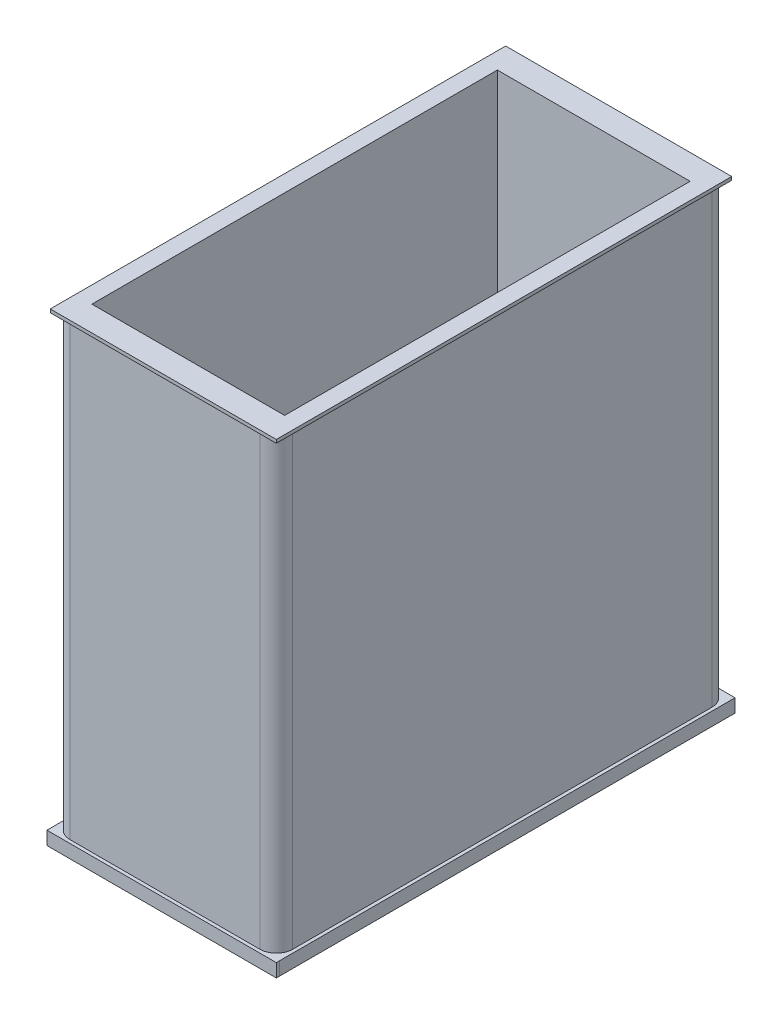
from build123d import *

# Parameters (mm, degrees)
SKETCH1_W            = 169.926
SKETCH1_H            = 344.932
BOSS_EXTRUDE1_DEPTH  = 379.984
SKETCH7_W            = 344.932
SKETCH7_H            = 10.16
BOSS_EXTRUDE4_DEPTH  = 2.54
SKETCH8_W            = 344.932
SKETCH8_H            = 10.16
BOSS_EXTRUDE5_DEPTH  = 2.54
SKETCH9_W            = 175.006
SKETCH9_H            = 10.16
BOSS_EXTRUDE6_DEPTH  = 2.54
SKETCH13_W           = 344.932
SKETCH13_H           = 2.54
BOSS_EXTRUDE9_DEPTH  = 1.27
SKETCH14_W           = 171.196
SKETCH14_H           = 2.54
BOSS_EXTRUDE10_DEPTH = 1.27
SKETCH15_W           = 346.202
SKETCH15_H           = 2.54
BOSS_EXTRUDE11_DEPTH = 1.27
SKETCH16_W           = 172.466
SKETCH16_H           = 2.54
BOSS_EXTRUDE12_DEPTH = 1.27
FILLET1_R            = 12.54
SKETCH23_W           = 175.014872456
SKETCH23_H           = 10.16
BOSS_EXTRUDE15_DEPTH = 2.54
SKETCH25_W           = 180.28813578
SKETCH25_H           = 28.656047844
CUT_EXTRUDE1_DEPTH   = 474.472
SKETCH26_W           = 147.066
SKETCH26_H           = 309.372
CUT_EXTRUDE2_DEPTH   = 345.948


with BuildPart() as part:
    # Sketch1 → Boss-Extrude1 (new body)
    with BuildSketch(Plane(origin=(0, 0, 0), x_dir=(1, 0, 0), z_dir=(0, 1, 0))):
        with Locations((18.629158276, -37.477981942)):
            Rectangle(SKETCH1_W, SKETCH1_H)
    extrude(amount=BOSS_EXTRUDE1_DEPTH)

    # Sketch7 → Boss-Extrude4 (add)
    with BuildSketch(Plane.ZY.offset(66.333841724)):
        with Locations((37.477981942, 5.08)):
            Rectangle(SKETCH7_W, SKETCH7_H)
    extrude(amount=BOSS_EXTRUDE4_DEPTH)

    # Sketch8 → Boss-Extrude5 (add)
    with BuildSketch(Plane(origin=(103.592158276, 0, 0), x_dir=(0, 0, -1), z_dir=(1, 0, 0))):
        with Locations((-37.477981942, 5.08)):
            Rectangle(SKETCH8_W, SKETCH8_H)
    extrude(amount=BOSS_EXTRUDE5_DEPTH)

    # Sketch9 → Boss-Extrude6 (add)
    with BuildSketch(Plane(origin=(0, 0, -134.988018058), x_dir=(-1, 0, 0), z_dir=(0, 0, -1))):
        with Locations((-18.629158276, 5.08)):
            Rectangle(SKETCH9_W, SKETCH9_H)
    extrude(amount=BOSS_EXTRUDE6_DEPTH)

    # Sketch13 → Boss-Extrude9 (add)
    with BuildSketch(Plane(origin=(103.592158276, 0, 0), x_dir=(0, 0, -1), z_dir=(1, 0, 0))):
        with Locations((-37.477981942, 353.314)):
            Rectangle(SKETCH13_W, SKETCH13_H)
    extrude(amount=BOSS_EXTRUDE9_DEPTH)

    # Sketch14 → Boss-Extrude10 (add)
    with BuildSketch(Plane(origin=(0, 0, -134.988018058), x_dir=(-1, 0, 0), z_dir=(0, 0, -1))):
        with Locations((-19.264158276, 353.314)):
            Rectangle(SKETCH14_W, SKETCH14_H)
    extrude(amount=BOSS_EXTRUDE10_DEPTH)

    # Sketch15 → Boss-Extrude11 (add)
    with BuildSketch(Plane.ZY.offset(66.333841724)):
        with Locations((36.842981942, 353.314)):
            Rectangle(SKETCH15_W, SKETCH15_H)
    extrude(amount=BOSS_EXTRUDE11_DEPTH)

    # Sketch16 → Boss-Extrude12 (add)
    with BuildSketch(Plane.XY.offset(209.943981942)):
        with Locations((18.629158276, 353.314)):
            Rectangle(SKETCH16_W, SKETCH16_H)
    extrude(amount=BOSS_EXTRUDE12_DEPTH)

    # Fillet1
    fillet1_edges = [part.edges().sort_by_distance(p)[0] for p in [
        (103.592158276, 181.102, -134.988018058),
    ]]
    fillet(fillet1_edges, radius=FILLET1_R)
    fillet1_2_edges = [part.edges().sort_by_distance(p)[0] for p in [
        (-66.333841724, 181.102, -134.988018058),
    ]]
    fillet(fillet1_2_edges, radius=FILLET1_R)
    fillet1_3_edges = [part.edges().sort_by_distance(p)[0] for p in [
        (-66.333841724, 181.102, 209.943981942),
    ]]
    fillet(fillet1_3_edges, radius=FILLET1_R)
    fillet1_4_edges = [part.edges().sort_by_distance(p)[0] for p in [
        (103.592158276, 181.102, 209.943981942),
    ]]
    fillet(fillet1_4_edges, radius=FILLET1_R)
    fillet1_5_edges = [part.edges().sort_by_distance(p)[0] for p in [
        (18.629158276, 379.984, 209.943981942),
    ]]
    fillet(fillet1_5_edges, radius=FILLET1_R)
    fillet1_6_edges = [part.edges().sort_by_distance(p)[0] for p in [
        (103.592158276, 361.014, 209.943981942),
    ]]
    fillet(fillet1_6_edges, radius=FILLET1_R)
    fillet1_7_edges = [part.edges().sort_by_distance(p)[0] for p in [
        (12.359158276, 379.984, -134.988018058),
    ]]
    fillet(fillet1_7_edges, radius=FILLET1_R)
    fillet1_8_edges = [part.edges().sort_by_distance(p)[0] for p in [
        (-66.333841724, 379.984, 37.477981942),
    ]]
    fillet(fillet1_8_edges, radius=FILLET1_R)

    # Sketch23 → Boss-Extrude15 (add)
    with BuildSketch(Plane.XY.offset(209.943981942)):
        with Locations((18.633594504, 5.08)):
            Rectangle(SKETCH23_W, SKETCH23_H)
    extrude(amount=BOSS_EXTRUDE15_DEPTH)

    # Sketch25 → Cut-Extrude1 (cut)
    with BuildSketch(Plane(origin=(0, 0, -134.988018058), x_dir=(-1, 0, 0), z_dir=(0, 0, -1))):
        with Locations((-13.448090386, 368.912023922)):
            Rectangle(SKETCH25_W, SKETCH25_H)
    extrude(amount=-CUT_EXTRUDE1_DEPTH, mode=Mode.SUBTRACT)

    # Sketch26 → Cut-Extrude2 (cut)
    with BuildSketch(Plane(origin=(0, 354.584, 0), x_dir=(1, 0, 0), z_dir=(0, 1, 0))):
        with Locations((18.629158276, -37.477981942)):
            Rectangle(SKETCH26_W, SKETCH26_H)
    extrude(amount=-CUT_EXTRUDE2_DEPTH, mode=Mode.SUBTRACT)


solid = part.part
